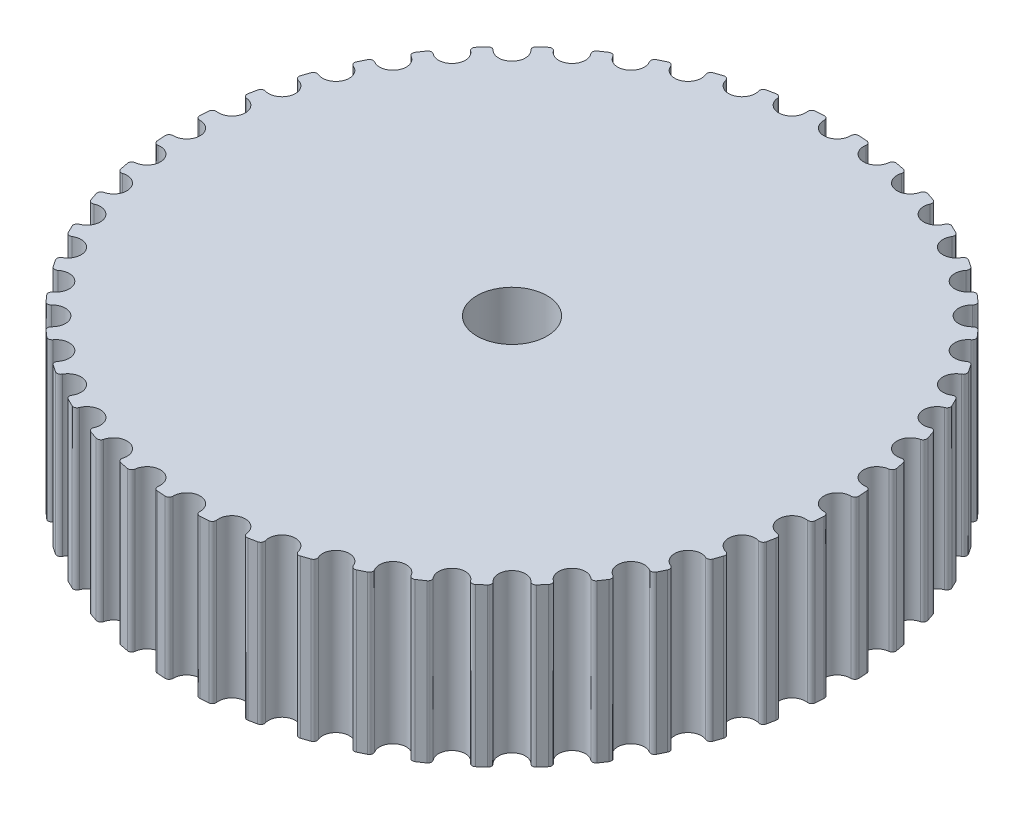
from build123d import *

# Parameters (mm, degrees)
AUFSATZ_LINEAR_AUSTRAGEN1_DEPTH = 18
F_8_0_8_DURCHMESSER_BOHRUNG1_D  = 8


with BuildPart() as part:
    # Skizze1 → Aufsatz-Linear austragen1 (new body)
    with BuildSketch(Plane(origin=(0, 0, 0), x_dir=(1, 0, 0), z_dir=(0, 1, 0))):
        with BuildLine():
            Line((1.98238775, 37.572704303), (2.938793876, 37.510018134))
            ThreePointArc((2.938793876, 37.510018134), (3.246775364, 37.349143087), (3.335291888, 37.013139809))
            ThreePointArc((3.335291888, 37.013139809), (3.618732929, 35.861010692), (4.642164026, 35.260736495))
            ThreePointArc((4.642164026, 35.260736495), (5.78608495, 35.575673386), (6.358060929, 36.615184715))
            ThreePointArc((6.358060929, 36.615184715), (6.530525373, 36.916829196), (6.869650172, 36.992511085))
            Line((6.869650172, 36.992511085), (7.809691924, 36.805525155))
            ThreePointArc((7.809691924, 36.805525155), (8.09404018, 36.605826765), (8.137942205, 36.261144317))
            ThreePointArc((8.137942205, 36.261144317), (8.268575342, 35.081875345), (9.204899339, 34.353152012))
            ThreePointArc((9.204899339, 34.353152012), (10.380141373, 34.516082932), (11.082907474, 35.472043251))
            ThreePointArc((11.082907474, 35.472043251), (11.293268967, 35.748595995), (11.639370975, 35.779365746))
            Line((11.639370975, 35.779365746), (12.546963978, 35.471279435))
            ThreePointArc((12.546963978, 35.471279435), (12.802813725, 35.236174598), (12.801350074, 34.888710592))
            ThreePointArc((12.801350074, 34.888710592), (12.776940138, 33.702479384), (13.610136272, 32.857775574))
            ThreePointArc((13.610136272, 32.857775574), (14.7965907, 32.865912729), (15.6181224, 33.721965292))
            ThreePointArc((15.6181224, 33.721965292), (15.862781598, 33.968694404), (16.209938914, 33.954025538))
            Line((16.209938914, 33.954025538), (17.069554, 33.530110291))
            ThreePointArc((17.069554, 33.530110291), (17.292527578, 33.263621714), (17.245723295, 32.919321356))
            ThreePointArc((17.245723295, 32.919321356), (17.066687946, 31.746424656), (17.7825, 30.800193486))
            ThreePointArc((17.7825, 30.800193486), (18.959866258, 30.653397648), (19.886106922, 31.394895158))
            ThreePointArc((19.886106922, 31.394895158), (20.160877638, 31.607579035), (20.503150303, 31.54772254))
            Line((20.503150303, 31.54772254), (21.30007922, 31.015231662))
            ThreePointArc((21.30007922, 31.015231662), (21.486361489, 30.721919041), (21.395017408, 30.386673404))
            ThreePointArc((21.395017408, 30.386673404), (21.064419992, 29.247179801), (21.650600223, 28.215611547))
            ThreePointArc((21.650600223, 28.215611547), (22.798733248, 27.916394434), (23.813834641, 28.530649663))
            ThreePointArc((23.813834641, 28.530649663), (24.114015471, 28.705649225), (24.445547107, 28.601629263))
            Line((24.445547107, 28.601629263), (25.166154179, 27.969673821))
            ThreePointArc((25.166154179, 27.969673821), (25.312557798, 27.654555815), (25.178236842, 27.334101046))
            ThreePointArc((25.178236842, 27.334101046), (24.701733971, 26.24750759), (25.148252673, 25.148252673))
            ThreePointArc((25.148252673, 25.148252673), (26.24750759, 24.701733971), (27.334101046, 25.178236842))
            ThreePointArc((27.334101046, 25.178236842), (27.654555815, 25.312557798), (27.969673821, 25.166154179))
            Line((27.969673821, 25.166154179), (28.601629263, 24.445547107))
            ThreePointArc((28.601629263, 24.445547107), (28.705649225, 24.114015471), (28.530649663, 23.813834641))
            ThreePointArc((28.530649663, 23.813834641), (27.916394434, 22.798733248), (28.215611547, 21.650600223))
            ThreePointArc((28.215611547, 21.650600223), (29.247179801, 21.064419992), (30.386673404, 21.395017408))
            ThreePointArc((30.386673404, 21.395017408), (30.721919041, 21.486361489), (31.015231662, 21.30007922))
            Line((31.015231662, 21.30007922), (31.54772254, 20.503150303))
            ThreePointArc((31.54772254, 20.503150303), (31.607579035, 20.160877638), (31.394895158, 19.886106922))
            ThreePointArc((31.394895158, 19.886106922), (30.653397648, 18.959866258), (30.800193486, 17.7825))
            ThreePointArc((30.800193486, 17.7825), (31.746424656, 17.066687946), (32.919321356, 17.245723295))
            ThreePointArc((32.919321356, 17.245723295), (33.263621714, 17.292527578), (33.530110291, 17.069554))
            Line((33.530110291, 17.069554), (33.954025538, 16.209938914))
            ThreePointArc((33.954025538, 16.209938914), (33.968694404, 15.862781598), (33.721965292, 15.6181224))
            ThreePointArc((33.721965292, 15.6181224), (32.865912729, 14.7965907), (32.857775574, 13.610136272))
            ThreePointArc((32.857775574, 13.610136272), (33.702479384, 12.776940138), (34.888710592, 12.801350074))
            ThreePointArc((34.888710592, 12.801350074), (35.236174598, 12.802813725), (35.471279435, 12.546963978))
            Line((35.471279435, 12.546963978), (35.779365746, 11.639370975))
            ThreePointArc((35.779365746, 11.639370975), (35.748595995, 11.293268967), (35.472043251, 11.082907474))
            ThreePointArc((35.472043251, 11.082907474), (34.516082932, 10.380141373), (34.353152012, 9.204899339))
            ThreePointArc((34.353152012, 9.204899339), (35.081875345, 8.268575342), (36.261144317, 8.137942205))
            ThreePointArc((36.261144317, 8.137942205), (36.605826765, 8.09404018), (36.805525155, 7.809691924))
            Line((36.805525155, 7.809691924), (36.992511085, 6.869650172))
            ThreePointArc((36.992511085, 6.869650172), (36.916829196, 6.530525373), (36.615184715, 6.358060929))
            ThreePointArc((36.615184715, 6.358060929), (35.575673386, 5.78608495), (35.260736495, 4.642164026))
            ThreePointArc((35.260736495, 4.642164026), (35.861010692, 3.618732929), (37.013139809, 3.335291888))
            ThreePointArc((37.013139809, 3.335291888), (37.349143087, 3.246775364), (37.510018134, 2.938793876))
            Line((37.510018134, 2.938793876), (37.572704303, 1.98238775))
            ThreePointArc((37.572704303, 1.98238775), (37.453405215, 1.656042679), (37.131830217, 1.524426198))
            ThreePointArc((37.131830217, 1.524426198), (36.026554205, 1.093027008), (35.565, 0))
            ThreePointArc((35.565, 0), (36.026554205, -1.093027008), (37.131830217, -1.524426198))
            ThreePointArc((37.131830217, -1.524426198), (37.453405215, -1.656042679), (37.572704303, -1.98238775))
            Line((37.572704303, -1.98238775), (37.510018134, -2.938793876))
            ThreePointArc((37.510018134, -2.938793876), (37.349143087, -3.246775364), (37.013139809, -3.335291888))
            ThreePointArc((37.013139809, -3.335291888), (35.861010692, -3.618732929), (35.260736495, -4.642164026))
            ThreePointArc((35.260736495, -4.642164026), (35.575673386, -5.78608495), (36.615184715, -6.358060929))
            ThreePointArc((36.615184715, -6.358060929), (36.916829196, -6.530525373), (36.992511085, -6.869650172))
            Line((36.992511085, -6.869650172), (36.805525155, -7.809691924))
            ThreePointArc((36.805525155, -7.809691924), (36.605826765, -8.09404018), (36.261144317, -8.137942205))
            ThreePointArc((36.261144317, -8.137942205), (35.081875345, -8.268575342), (34.353152012, -9.204899339))
            ThreePointArc((34.353152012, -9.204899339), (34.516082932, -10.380141373), (35.472043251, -11.082907474))
            ThreePointArc((35.472043251, -11.082907474), (35.748595995, -11.293268967), (35.779365746, -11.639370975))
            Line((35.779365746, -11.639370975), (35.471279435, -12.546963978))
            ThreePointArc((35.471279435, -12.546963978), (35.236174598, -12.802813725), (34.888710592, -12.801350074))
            ThreePointArc((34.888710592, -12.801350074), (33.702479384, -12.776940138), (32.857775574, -13.610136272))
            ThreePointArc((32.857775574, -13.610136272), (32.865912729, -14.7965907), (33.721965292, -15.6181224))
            ThreePointArc((33.721965292, -15.6181224), (33.968694404, -15.862781598), (33.954025538, -16.209938914))
            Line((33.954025538, -16.209938914), (33.530110291, -17.069554))
            ThreePointArc((33.530110291, -17.069554), (33.263621714, -17.292527578), (32.919321356, -17.245723295))
            ThreePointArc((32.919321356, -17.245723295), (31.746424656, -17.066687946), (30.800193486, -17.7825))
            ThreePointArc((30.800193486, -17.7825), (30.653397648, -18.959866258), (31.394895158, -19.886106922))
            ThreePointArc((31.394895158, -19.886106922), (31.607579035, -20.160877638), (31.54772254, -20.503150303))
            Line((31.54772254, -20.503150303), (31.015231662, -21.30007922))
            ThreePointArc((31.015231662, -21.30007922), (30.721919041, -21.486361489), (30.386673404, -21.395017408))
            ThreePointArc((30.386673404, -21.395017408), (29.247179801, -21.064419992), (28.215611547, -21.650600223))
            ThreePointArc((28.215611547, -21.650600223), (27.916394434, -22.798733248), (28.530649663, -23.813834641))
            ThreePointArc((28.530649663, -23.813834641), (28.705649225, -24.114015471), (28.601629263, -24.445547107))
            Line((28.601629263, -24.445547107), (27.969673821, -25.166154179))
            ThreePointArc((27.969673821, -25.166154179), (27.654555815, -25.312557798), (27.334101046, -25.178236842))
            ThreePointArc((27.334101046, -25.178236842), (26.24750759, -24.701733971), (25.148252673, -25.148252673))
            ThreePointArc((25.148252673, -25.148252673), (24.701733971, -26.24750759), (25.178236842, -27.334101046))
            ThreePointArc((25.178236842, -27.334101046), (25.312557798, -27.654555815), (25.166154179, -27.969673821))
            Line((25.166154179, -27.969673821), (24.445547107, -28.601629263))
            ThreePointArc((24.445547107, -28.601629263), (24.114015471, -28.705649225), (23.813834641, -28.530649663))
            ThreePointArc((23.813834641, -28.530649663), (22.798733248, -27.916394434), (21.650600223, -28.215611547))
            ThreePointArc((21.650600223, -28.215611547), (21.064419992, -29.247179801), (21.395017408, -30.386673404))
            ThreePointArc((21.395017408, -30.386673404), (21.486361489, -30.721919041), (21.30007922, -31.015231662))
            Line((21.30007922, -31.015231662), (20.503150303, -31.54772254))
            ThreePointArc((20.503150303, -31.54772254), (20.160877638, -31.607579035), (19.886106922, -31.394895158))
            ThreePointArc((19.886106922, -31.394895158), (18.959866258, -30.653397648), (17.7825, -30.800193486))
            ThreePointArc((17.7825, -30.800193486), (17.066687946, -31.746424656), (17.245723295, -32.919321356))
            ThreePointArc((17.245723295, -32.919321356), (17.292527578, -33.263621714), (17.069554, -33.530110291))
            Line((17.069554, -33.530110291), (16.209938914, -33.954025538))
            ThreePointArc((16.209938914, -33.954025538), (15.862781598, -33.968694404), (15.6181224, -33.721965292))
            ThreePointArc((15.6181224, -33.721965292), (14.7965907, -32.865912729), (13.610136272, -32.857775574))
            ThreePointArc((13.610136272, -32.857775574), (12.776940138, -33.702479384), (12.801350074, -34.888710592))
            ThreePointArc((12.801350074, -34.888710592), (12.802813725, -35.236174598), (12.546963978, -35.471279435))
            Line((12.546963978, -35.471279435), (11.639370975, -35.779365746))
            ThreePointArc((11.639370975, -35.779365746), (11.293268967, -35.748595995), (11.082907474, -35.472043251))
            ThreePointArc((11.082907474, -35.472043251), (10.380141373, -34.516082932), (9.204899339, -34.353152012))
            ThreePointArc((9.204899339, -34.353152012), (8.268575342, -35.081875345), (8.137942205, -36.261144317))
            ThreePointArc((8.137942205, -36.261144317), (8.09404018, -36.605826765), (7.809691924, -36.805525155))
            Line((7.809691924, -36.805525155), (6.869650172, -36.992511085))
            ThreePointArc((6.869650172, -36.992511085), (6.530525373, -36.916829196), (6.358060929, -36.615184715))
            ThreePointArc((6.358060929, -36.615184715), (5.78608495, -35.575673386), (4.642164026, -35.260736495))
            ThreePointArc((4.642164026, -35.260736495), (3.618732929, -35.861010692), (3.335291888, -37.013139809))
            ThreePointArc((3.335291888, -37.013139809), (3.246775364, -37.349143087), (2.938793876, -37.510018134))
            Line((2.938793876, -37.510018134), (1.98238775, -37.572704303))
            ThreePointArc((1.98238775, -37.572704303), (1.656042679, -37.453405215), (1.524426198, -37.131830217))
            ThreePointArc((1.524426198, -37.131830217), (1.093027008, -36.026554205), (0, -35.565))
            ThreePointArc((0, -35.565), (-1.093027008, -36.026554205), (-1.524426198, -37.131830217))
            ThreePointArc((-1.524426198, -37.131830217), (-1.656042679, -37.453405215), (-1.98238775, -37.572704303))
            Line((-1.98238775, -37.572704303), (-2.938793876, -37.510018134))
            ThreePointArc((-2.938793876, -37.510018134), (-3.246775364, -37.349143087), (-3.335291888, -37.013139809))
            ThreePointArc((-3.335291888, -37.013139809), (-3.618732929, -35.861010692), (-4.642164026, -35.260736495))
            ThreePointArc((-4.642164026, -35.260736495), (-5.78608495, -35.575673386), (-6.358060929, -36.615184715))
            ThreePointArc((-6.358060929, -36.615184715), (-6.530525373, -36.916829196), (-6.869650172, -36.992511085))
            Line((-6.869650172, -36.992511085), (-7.809691924, -36.805525155))
            ThreePointArc((-7.809691924, -36.805525155), (-8.09404018, -36.605826765), (-8.137942205, -36.261144317))
            ThreePointArc((-8.137942205, -36.261144317), (-8.268575342, -35.081875345), (-9.204899339, -34.353152012))
            ThreePointArc((-9.204899339, -34.353152012), (-10.380141373, -34.516082932), (-11.082907474, -35.472043251))
            ThreePointArc((-11.082907474, -35.472043251), (-11.293268967, -35.748595995), (-11.639370975, -35.779365746))
            Line((-11.639370975, -35.779365746), (-12.546963978, -35.471279435))
            ThreePointArc((-12.546963978, -35.471279435), (-12.802813725, -35.236174598), (-12.801350074, -34.888710592))
            ThreePointArc((-12.801350074, -34.888710592), (-12.776940138, -33.702479384), (-13.610136272, -32.857775574))
            ThreePointArc((-13.610136272, -32.857775574), (-14.7965907, -32.865912729), (-15.6181224, -33.721965292))
            ThreePointArc((-15.6181224, -33.721965292), (-15.862781598, -33.968694404), (-16.209938914, -33.954025538))
            Line((-16.209938914, -33.954025538), (-17.069554, -33.530110291))
            ThreePointArc((-17.069554, -33.530110291), (-17.292527578, -33.263621714), (-17.245723295, -32.919321356))
            ThreePointArc((-17.245723295, -32.919321356), (-17.066687946, -31.746424656), (-17.7825, -30.800193486))
            ThreePointArc((-17.7825, -30.800193486), (-18.959866258, -30.653397648), (-19.886106922, -31.394895158))
            ThreePointArc((-19.886106922, -31.394895158), (-20.160877638, -31.607579035), (-20.503150303, -31.54772254))
            Line((-20.503150303, -31.54772254), (-21.30007922, -31.015231662))
            ThreePointArc((-21.30007922, -31.015231662), (-21.486361489, -30.721919041), (-21.395017408, -30.386673404))
            ThreePointArc((-21.395017408, -30.386673404), (-21.064419992, -29.247179801), (-21.650600223, -28.215611547))
            ThreePointArc((-21.650600223, -28.215611547), (-22.798733248, -27.916394434), (-23.813834641, -28.530649663))
            ThreePointArc((-23.813834641, -28.530649663), (-24.114015471, -28.705649225), (-24.445547107, -28.601629263))
            Line((-24.445547107, -28.601629263), (-25.166154179, -27.969673821))
            ThreePointArc((-25.166154179, -27.969673821), (-25.312557798, -27.654555815), (-25.178236842, -27.334101046))
            ThreePointArc((-25.178236842, -27.334101046), (-24.701733971, -26.24750759), (-25.148252673, -25.148252673))
            ThreePointArc((-25.148252673, -25.148252673), (-26.24750759, -24.701733971), (-27.334101046, -25.178236842))
            ThreePointArc((-27.334101046, -25.178236842), (-27.654555815, -25.312557798), (-27.969673821, -25.166154179))
            Line((-27.969673821, -25.166154179), (-28.601629263, -24.445547107))
            ThreePointArc((-28.601629263, -24.445547107), (-28.705649225, -24.114015471), (-28.530649663, -23.813834641))
            ThreePointArc((-28.530649663, -23.813834641), (-27.916394434, -22.798733248), (-28.215611547, -21.650600223))
            ThreePointArc((-28.215611547, -21.650600223), (-29.247179801, -21.064419992), (-30.386673404, -21.395017408))
            ThreePointArc((-30.386673404, -21.395017408), (-30.721919041, -21.486361489), (-31.015231662, -21.30007922))
            Line((-31.015231662, -21.30007922), (-31.54772254, -20.503150303))
            ThreePointArc((-31.54772254, -20.503150303), (-31.607579035, -20.160877638), (-31.394895158, -19.886106922))
            ThreePointArc((-31.394895158, -19.886106922), (-30.653397648, -18.959866258), (-30.800193486, -17.7825))
            ThreePointArc((-30.800193486, -17.7825), (-31.746424656, -17.066687946), (-32.919321356, -17.245723295))
            ThreePointArc((-32.919321356, -17.245723295), (-33.263621714, -17.292527578), (-33.530110291, -17.069554))
            Line((-33.530110291, -17.069554), (-33.954025538, -16.209938914))
            ThreePointArc((-33.954025538, -16.209938914), (-33.968694404, -15.862781598), (-33.721965292, -15.6181224))
            ThreePointArc((-33.721965292, -15.6181224), (-32.865912729, -14.7965907), (-32.857775574, -13.610136272))
            ThreePointArc((-32.857775574, -13.610136272), (-33.702479384, -12.776940138), (-34.888710592, -12.801350074))
            ThreePointArc((-34.888710592, -12.801350074), (-35.236174598, -12.802813725), (-35.471279435, -12.546963978))
            Line((-35.471279435, -12.546963978), (-35.779365746, -11.639370975))
            ThreePointArc((-35.779365746, -11.639370975), (-35.748595995, -11.293268967), (-35.472043251, -11.082907474))
            ThreePointArc((-35.472043251, -11.082907474), (-34.516082932, -10.380141373), (-34.353152012, -9.204899339))
            ThreePointArc((-34.353152012, -9.204899339), (-35.081875345, -8.268575342), (-36.261144317, -8.137942205))
            ThreePointArc((-36.261144317, -8.137942205), (-36.605826765, -8.09404018), (-36.805525155, -7.809691924))
            Line((-36.805525155, -7.809691924), (-36.992511085, -6.869650172))
            ThreePointArc((-36.992511085, -6.869650172), (-36.916829196, -6.530525373), (-36.615184715, -6.358060929))
            ThreePointArc((-36.615184715, -6.358060929), (-35.575673386, -5.78608495), (-35.260736495, -4.642164026))
            ThreePointArc((-35.260736495, -4.642164026), (-35.861010692, -3.618732929), (-37.013139809, -3.335291888))
            ThreePointArc((-37.013139809, -3.335291888), (-37.349143087, -3.246775364), (-37.510018134, -2.938793876))
            Line((-37.510018134, -2.938793876), (-37.572704303, -1.98238775))
            ThreePointArc((-37.572704303, -1.98238775), (-37.453405215, -1.656042679), (-37.131830217, -1.524426198))
            ThreePointArc((-37.131830217, -1.524426198), (-36.026554205, -1.093027008), (-35.565, 0))
            ThreePointArc((-35.565, 0), (-36.026554205, 1.093027008), (-37.131830217, 1.524426198))
            ThreePointArc((-37.131830217, 1.524426198), (-37.453405215, 1.656042679), (-37.572704303, 1.98238775))
            Line((-37.572704303, 1.98238775), (-37.510018134, 2.938793876))
            ThreePointArc((-37.510018134, 2.938793876), (-37.349143087, 3.246775364), (-37.013139809, 3.335291888))
            ThreePointArc((-37.013139809, 3.335291888), (-35.861010692, 3.618732929), (-35.260736495, 4.642164026))
            ThreePointArc((-35.260736495, 4.642164026), (-35.575673386, 5.78608495), (-36.615184715, 6.358060929))
            ThreePointArc((-36.615184715, 6.358060929), (-36.916829196, 6.530525373), (-36.992511085, 6.869650172))
            Line((-36.992511085, 6.869650172), (-36.805525155, 7.809691924))
            ThreePointArc((-36.805525155, 7.809691924), (-36.605826765, 8.09404018), (-36.261144317, 8.137942205))
            ThreePointArc((-36.261144317, 8.137942205), (-35.081875345, 8.268575342), (-34.353152012, 9.204899339))
            ThreePointArc((-34.353152012, 9.204899339), (-34.516082932, 10.380141373), (-35.472043251, 11.082907474))
            ThreePointArc((-35.472043251, 11.082907474), (-35.748595995, 11.293268967), (-35.779365746, 11.639370975))
            Line((-35.779365746, 11.639370975), (-35.471279435, 12.546963978))
            ThreePointArc((-35.471279435, 12.546963978), (-35.236174598, 12.802813725), (-34.888710592, 12.801350074))
            ThreePointArc((-34.888710592, 12.801350074), (-33.702479384, 12.776940138), (-32.857775574, 13.610136272))
            ThreePointArc((-32.857775574, 13.610136272), (-32.865912729, 14.7965907), (-33.721965292, 15.6181224))
            ThreePointArc((-33.721965292, 15.6181224), (-33.968694404, 15.862781598), (-33.954025538, 16.209938914))
            Line((-33.954025538, 16.209938914), (-33.530110291, 17.069554))
            ThreePointArc((-33.530110291, 17.069554), (-33.263621714, 17.292527578), (-32.919321356, 17.245723295))
            ThreePointArc((-32.919321356, 17.245723295), (-31.746424656, 17.066687946), (-30.800193486, 17.7825))
            ThreePointArc((-30.800193486, 17.7825), (-30.653397648, 18.959866258), (-31.394895158, 19.886106922))
            ThreePointArc((-31.394895158, 19.886106922), (-31.607579035, 20.160877638), (-31.54772254, 20.503150303))
            Line((-31.54772254, 20.503150303), (-31.015231662, 21.30007922))
            ThreePointArc((-31.015231662, 21.30007922), (-30.721919041, 21.486361489), (-30.386673404, 21.395017408))
            ThreePointArc((-30.386673404, 21.395017408), (-29.247179801, 21.064419992), (-28.215611547, 21.650600223))
            ThreePointArc((-28.215611547, 21.650600223), (-27.916394434, 22.798733248), (-28.530649663, 23.813834641))
            ThreePointArc((-28.530649663, 23.813834641), (-28.705649225, 24.114015471), (-28.601629263, 24.445547107))
            Line((-28.601629263, 24.445547107), (-27.969673821, 25.166154179))
            ThreePointArc((-27.969673821, 25.166154179), (-27.654555815, 25.312557798), (-27.334101046, 25.178236842))
            ThreePointArc((-27.334101046, 25.178236842), (-26.24750759, 24.701733971), (-25.148252673, 25.148252673))
            ThreePointArc((-25.148252673, 25.148252673), (-24.701733971, 26.24750759), (-25.178236842, 27.334101046))
            ThreePointArc((-25.178236842, 27.334101046), (-25.312557798, 27.654555815), (-25.166154179, 27.969673821))
            Line((-25.166154179, 27.969673821), (-24.445547107, 28.601629263))
            ThreePointArc((-24.445547107, 28.601629263), (-24.114015471, 28.705649225), (-23.813834641, 28.530649663))
            ThreePointArc((-23.813834641, 28.530649663), (-22.798733248, 27.916394434), (-21.650600223, 28.215611547))
            ThreePointArc((-21.650600223, 28.215611547), (-21.064419992, 29.247179801), (-21.395017408, 30.386673404))
            ThreePointArc((-21.395017408, 30.386673404), (-21.486361489, 30.721919041), (-21.30007922, 31.015231662))
            Line((-21.30007922, 31.015231662), (-20.503150303, 31.54772254))
            ThreePointArc((-20.503150303, 31.54772254), (-20.160877638, 31.607579035), (-19.886106922, 31.394895158))
            ThreePointArc((-19.886106922, 31.394895158), (-18.959866258, 30.653397648), (-17.7825, 30.800193486))
            ThreePointArc((-17.7825, 30.800193486), (-17.066687946, 31.746424656), (-17.245723295, 32.919321356))
            ThreePointArc((-17.245723295, 32.919321356), (-17.292527578, 33.263621714), (-17.069554, 33.530110291))
            Line((-17.069554, 33.530110291), (-16.209938914, 33.954025538))
            ThreePointArc((-16.209938914, 33.954025538), (-15.862781598, 33.968694404), (-15.6181224, 33.721965292))
            ThreePointArc((-15.6181224, 33.721965292), (-14.7965907, 32.865912729), (-13.610136272, 32.857775574))
            ThreePointArc((-13.610136272, 32.857775574), (-12.776940138, 33.702479384), (-12.801350074, 34.888710592))
            ThreePointArc((-12.801350074, 34.888710592), (-12.802813725, 35.236174598), (-12.546963978, 35.471279435))
            Line((-12.546963978, 35.471279435), (-11.639370975, 35.779365746))
            ThreePointArc((-11.639370975, 35.779365746), (-11.293268967, 35.748595995), (-11.082907474, 35.472043251))
            ThreePointArc((-11.082907474, 35.472043251), (-10.380141373, 34.516082932), (-9.204899339, 34.353152012))
            ThreePointArc((-9.204899339, 34.353152012), (-8.268575342, 35.081875345), (-8.137942205, 36.261144317))
            ThreePointArc((-8.137942205, 36.261144317), (-8.09404018, 36.605826765), (-7.809691924, 36.805525155))
            Line((-7.809691924, 36.805525155), (-6.869650172, 36.992511085))
            ThreePointArc((-6.869650172, 36.992511085), (-6.530525373, 36.916829196), (-6.358060929, 36.615184715))
            ThreePointArc((-6.358060929, 36.615184715), (-5.78608495, 35.575673386), (-4.642164026, 35.260736495))
            ThreePointArc((-4.642164026, 35.260736495), (-3.618732929, 35.861010692), (-3.335291888, 37.013139809))
            ThreePointArc((-3.335291888, 37.013139809), (-3.246775364, 37.349143087), (-2.938793876, 37.510018134))
            Line((-2.938793876, 37.510018134), (-1.98238775, 37.572704303))
            ThreePointArc((-1.98238775, 37.572704303), (-1.656042679, 37.453405215), (-1.524426198, 37.131830217))
            ThreePointArc((-1.524426198, 37.131830217), (-1.093027008, 36.026554205), (0, 35.565))
            ThreePointArc((0, 35.565), (1.093027008, 36.026554205), (1.524426198, 37.131830217))
            ThreePointArc((1.524426198, 37.131830217), (1.656042679, 37.453405215), (1.98238775, 37.572704303))
        make_face()
    extrude(amount=AUFSATZ_LINEAR_AUSTRAGEN1_DEPTH)

    # Ø8.0 (8) Durchmesser Bohrung1 (through all)
    with Locations(Plane(origin=(0, 18, 0), x_dir=(1, 0, 0), z_dir=(0, 1, 0))):
        with Locations((0, 0)):
            Hole(F_8_0_8_DURCHMESSER_BOHRUNG1_D / 2)


solid = part.part
